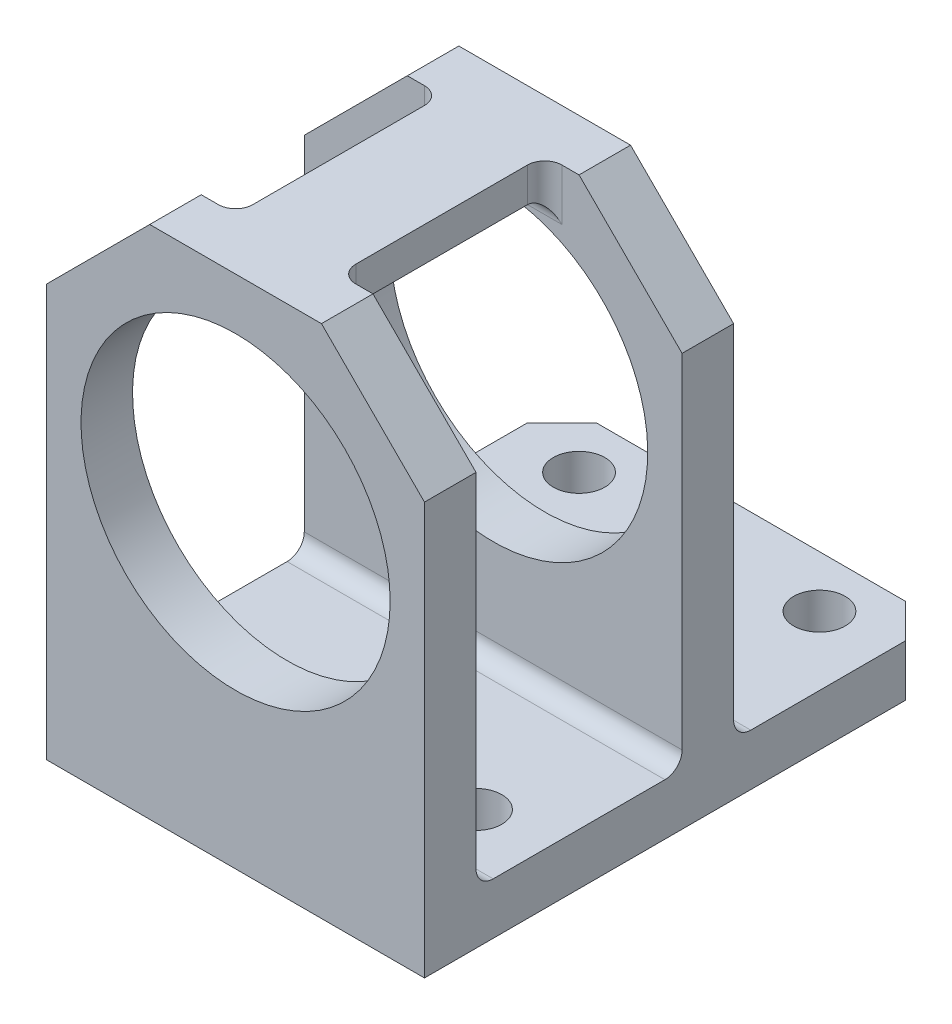
from build123d import *

# Parameters (mm, degrees)
SKETCH_1_W          = 22
SKETCH_1_H          = 30
SKETCH_1_R          = 9
EXTRUDE_2_DEPTH     = 30
SKETCH_4_W          = 12
SKETCH_4_H          = 25
SKETCH_4_H_2        = 30
CUT_EXTRUDE_3_DEPTH = 42.32795664
CHAMFER_2_SIZE      = 2
CUT_EXTRUDE_4_REACH = 45.829
SKETCH_6_R          = 1.5
CUT_EXTRUDE_5_DEPTH = 42.833001327
CHAMFER_3_SIZE      = 6
FILLET_1_R          = 1


with BuildPart() as part:
    # 草图1 → 凸台-拉伸2 (new body)
    with BuildSketch(Plane.XY):
        with Locations((0, -3)):
            Rectangle(SKETCH_1_W, SKETCH_1_H)
        Circle(SKETCH_1_R, mode=Mode.SUBTRACT)
    extrude(amount=EXTRUDE_2_DEPTH)

    # 草图4 → 切除-拉伸3 (cut, through all)
    with BuildSketch(Plane(origin=(11, 0, 0), x_dir=(0, 0, -1), z_dir=(1, 0, 0))):
        with Locations((-21, -2.5)):
            Rectangle(SKETCH_4_W, SKETCH_4_H)
        with Locations((-6, 0)):
            Rectangle(SKETCH_4_W, SKETCH_4_H_2)
    extrude(amount=-CUT_EXTRUDE_3_DEPTH, mode=Mode.SUBTRACT)

    # 倒角2
    chamfer_2_edges = [part.edges().sort_by_distance(p)[0] for p in [
        (-11, -16.5, 0),
        (11, -16.5, 0),
    ]]
    chamfer(chamfer_2_edges, length=CHAMFER_2_SIZE)

    # 草图5 → 切除-拉伸4 (cut, up to next)
    with BuildSketch(Plane(origin=(0, 12, 0), x_dir=(1, 0, 0), z_dir=(0, 1, 0)), mode=Mode.PRIVATE) as cut_extrude_4_sk1:
        with BuildLine():
            Line((3, -27), (9, -27))
            ThreePointArc((9, -27), (4.757359313, -25.242640687), (3, -21))
            Line((3, -21), (3, -27))
        make_face()
    cut_extrude_4_tool1 = extrude(cut_extrude_4_sk1.sketch, amount=-CUT_EXTRUDE_4_REACH, mode=Mode.PRIVATE) & part.part
    # 草图5 → 切除-拉伸4 (cut, up to next)
    with BuildSketch(Plane(origin=(0, 12, 0), x_dir=(1, 0, 0), z_dir=(0, 1, 0)), mode=Mode.PRIVATE) as cut_extrude_4_sk2:
        with BuildLine():
            Line((9, -27), (11, -27))
            Line((11, -27), (11, -15))
            Line((11, -15), (9, -15))
            ThreePointArc((9, -15), (4.757359313, -16.757359313), (3, -21))
            ThreePointArc((3, -21), (4.757359313, -25.242640687), (9, -27))
        make_face()
    cut_extrude_4_tool2 = extrude(cut_extrude_4_sk2.sketch, amount=-CUT_EXTRUDE_4_REACH, mode=Mode.PRIVATE) & part.part
    # 草图5 → 切除-拉伸4 (cut, up to next)
    with BuildSketch(Plane(origin=(0, 12, 0), x_dir=(1, 0, 0), z_dir=(0, 1, 0)), mode=Mode.PRIVATE) as cut_extrude_4_sk3:
        with BuildLine():
            Line((3, -15), (3, -21))
            ThreePointArc((3, -21), (4.757359313, -16.757359313), (9, -15))
            Line((9, -15), (3, -15))
        make_face()
    cut_extrude_4_tool3 = extrude(cut_extrude_4_sk3.sketch, amount=-CUT_EXTRUDE_4_REACH, mode=Mode.PRIVATE) & part.part
    cut_extrude_4_1 = cut_extrude_4_tool1.solids().sort_by_distance((4.340208, 12, 25.659792))[0]
    add(cut_extrude_4_1, mode=Mode.SUBTRACT)
    cut_extrude_4_2 = cut_extrude_4_tool2.solids().sort_by_distance((7.510217, 12, 21))[0]
    add(cut_extrude_4_2, mode=Mode.SUBTRACT)
    cut_extrude_4_3 = cut_extrude_4_tool3.solids().sort_by_distance((4.340208, 12, 16.340208))[0]
    add(cut_extrude_4_3, mode=Mode.SUBTRACT)
    cut_extrude_4 = cut_extrude_4_1 + cut_extrude_4_2 + cut_extrude_4_3  # 切除-拉伸4 as one shape, for the pattern or mirror that repeats it

    # 镜向1: 切除-拉伸4 across plane
    add(cut_extrude_4.mirror(Plane(origin=(0, 0, 0), x_dir=(0, 0, 1), z_dir=(1, 0, 0))), mode=Mode.SUBTRACT)

    # 草图6 → 切除-拉伸5 (cut, through all)
    with BuildSketch(Plane(origin=(0, -15, 0), x_dir=(1, 0, 0), z_dir=(0, 1, 0))):
        with Locations(Location((7, -23, 0), (0, 0, 180))):
            Circle(SKETCH_6_R)
        with Locations(Location((7, -3, 0), (0, 0, 180))):
            Circle(SKETCH_6_R)
        with Locations((-7, -3)):
            Circle(SKETCH_6_R)
        with Locations((-7, -23)):
            Circle(SKETCH_6_R)
    extrude(amount=-CUT_EXTRUDE_5_DEPTH, mode=Mode.SUBTRACT)

    # 倒角3
    chamfer_3_edges = [part.edges().sort_by_distance(p)[0] for p in [
        (11, 12, 13.5),
        (-11, 12, 28.5),
        (11, 12, 28.5),
        (-11, 12, 13.5),
    ]]
    chamfer(chamfer_3_edges, length=CHAMFER_3_SIZE)

    # 圆角1
    fillet_1_edges = [part.edges().sort_by_distance(p)[0] for p in [
        (0, -15, 27),
        (0, -15, 15),
        (0, -15, 12),
        (3, 11, 27),
        (3, 11, 15),
        (0, 10, 15),
        (0, 10, 27),
        (-3, 11, 27),
        (-3, 11, 15),
    ]]
    fillet(fillet_1_edges, radius=FILLET_1_R - 0.0001)  # a hair under: the kernel refuses the full size


solid = part.part
